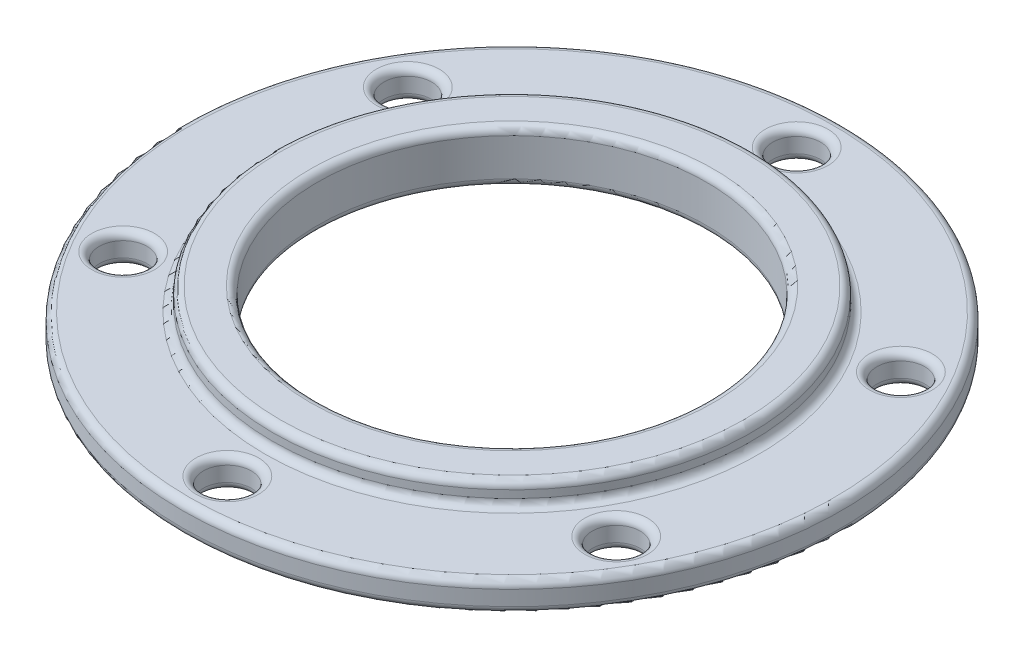
from build123d import *

# Parameters (mm, degrees)
SKETCH1_R           = 22.025
SKETCH1_R_2         = 1.6
SKETCH1_R_3         = 13
BOSS_EXTRUDE1_DEPTH = 2
BOSS_EXTRUDE2_START = 1.5
SKETCH2_R           = 16
SKETCH2_R_2         = 13
BOSS_EXTRUDE2_DEPTH = 1.5
FILLET1_R           = 0.5


with BuildPart() as part:
    # Sketch1 → Boss-Extrude1 (new body)
    with BuildSketch(Plane(origin=(0, 0, 0), x_dir=(1, 0, 0), z_dir=(0, 1, 0))):
        Circle(SKETCH1_R)
        with Locations((0, 19.025)):
            Circle(SKETCH1_R_2, mode=Mode.SUBTRACT)
        with Locations((16.476133307, 9.5125)):
            Circle(SKETCH1_R_2, mode=Mode.SUBTRACT)
        with Locations((16.476133307, -9.5125)):
            Circle(SKETCH1_R_2, mode=Mode.SUBTRACT)
        with Locations((0, -19.025)):
            Circle(SKETCH1_R_2, mode=Mode.SUBTRACT)
        with Locations((-16.476133307, -9.5125)):
            Circle(SKETCH1_R_2, mode=Mode.SUBTRACT)
        with Locations((-16.476133307, 9.5125)):
            Circle(SKETCH1_R_2, mode=Mode.SUBTRACT)
        Circle(SKETCH1_R_3, mode=Mode.SUBTRACT)
    extrude(amount=-BOSS_EXTRUDE1_DEPTH)

    # Sketch2 → Boss-Extrude2 (add)
    with BuildSketch(Plane(origin=(0, 0, 0), x_dir=(1, 0, 0), z_dir=(0, 1, 0)).offset(BOSS_EXTRUDE2_START)):
        Circle(SKETCH2_R)
        Circle(SKETCH2_R_2, mode=Mode.SUBTRACT)
    extrude(amount=-BOSS_EXTRUDE2_DEPTH)

    # Fillet1
    fillet1_edges = [part.edges().sort_by_distance(p)[0] for p in [
        (-22.025, 0, 0),
        (-1.6, 0, -19.025),
        (14.876133307, 0, -9.5125),
        (14.876133307, 0, 9.5125),
        (-1.6, 0, 19.025),
        (-18.076133307, 0, 9.5125),
        (-18.076133307, 0, -9.5125),
        (-22.025, -2, 0),
        (-1.6, -2, -19.025),
        (-13, -2, 0),
        (14.876133307, -2, -9.5125),
        (14.876133307, -2, 9.5125),
        (-1.6, -2, 19.025),
        (-18.076133307, -2, 9.5125),
        (-18.076133307, -2, -9.5125),
        (-16, 0, 0),
        (-13, 1.5, 0),
        (-16, 1.5, 0),
    ]]
    fillet(fillet1_edges, radius=FILLET1_R)


solid = part.part
